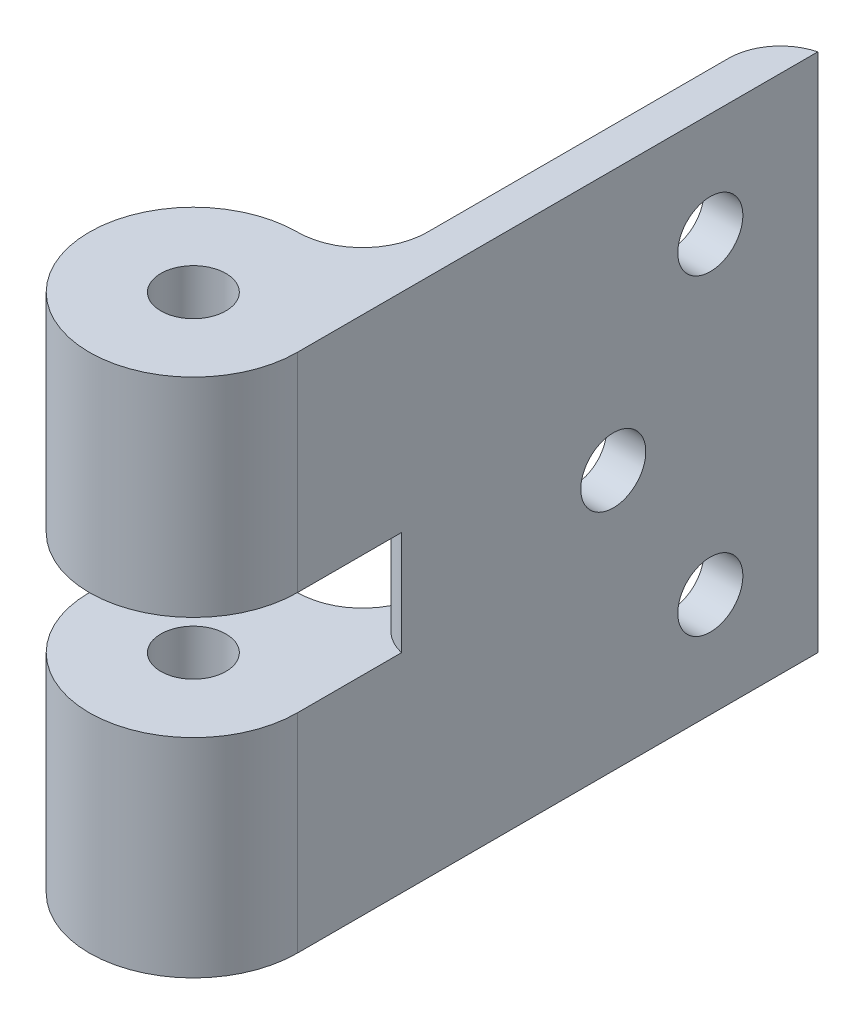
from build123d import *

# Parameters (mm, degrees)
SKETCH1_R               = 1.25
BOSS_EXTRUDE1_DEPTH     = 20
CUT_EXTRUDE1_DEPTH      = 30.021543722
CUT_EXTRUDE1_DEPTH_BACK = 30.021543722
SKETCH2_R               = 1.25
CUT_EXTRUDE2_DEPTH      = 29.565713714
CUT_EXTRUDE2_DEPTH_BACK = 29.565713714
SKETCH3_W               = 8
SKETCH3_H               = 4
FILLET1_R               = 2


with BuildPart() as part:
    # Sketch1 → Boss-Extrude1 (new body)
    with BuildSketch(Plane(origin=(0, 0, 0), x_dir=(1, 0, 0), z_dir=(0, 1, 0))):
        with BuildLine():
            Line((4, 0), (4, 20))
            Line((4, 20), (2.5, 20))
            Line((2.5, 20), (2.5, 15.120027663))
            Line((2.5, 15.120027663), (2.5, 6.5))
            ThreePointArc((2.5, 6.5), (1.767766953, 4.732233047), (0, 4))
            ThreePointArc((0, 4), (-2.828427125, -2.828427125), (4, 0))
        make_face()
        with Locations(Location((0, 0, 0), (0, 0, 270))):
            Circle(SKETCH1_R, mode=Mode.SUBTRACT)
    extrude(amount=BOSS_EXTRUDE1_DEPTH)

    # Sketch2 → Cut-Extrude1 (cut, two sides: drawn at the far end of the back side and taken through both)
    with BuildSketch(Plane.ZY.offset(-2.5).offset(-CUT_EXTRUDE1_DEPTH_BACK)):
        with Locations((-12.139236455, 10)):
            Circle(SKETCH2_R)
        with Locations((-15.86873762, 4)):
            Circle(SKETCH2_R)
        with Locations((-15.86873762, 16)):
            Circle(SKETCH2_R)
    extrude(amount=CUT_EXTRUDE1_DEPTH + CUT_EXTRUDE1_DEPTH_BACK, mode=Mode.SUBTRACT)

    # Sketch3 → Cut-Extrude2 (cut, two sides: drawn at the far end of the back side and taken through both)
    with BuildSketch(Plane(origin=(0, 0, 0), x_dir=(0, 0, -1), z_dir=(1, 0, 0)).offset(-CUT_EXTRUDE2_DEPTH_BACK)):
        with Locations((0, 10)):
            Rectangle(SKETCH3_W, SKETCH3_H)
    extrude(amount=CUT_EXTRUDE2_DEPTH + CUT_EXTRUDE2_DEPTH_BACK, mode=Mode.SUBTRACT)

    # Fillet1
    # the kernel refuses this fillet: 2 mm, written as the material it takes off along each edge
    with BuildSketch(Plane(origin=(2.5, -4.841229183, -20), x_dir=(0, 0, 1), z_dir=(0, 1, 0))) as fillet1_piece_1:
        with BuildLine():
            CenterArc((1.936491673, 2), FILLET1_R, 194.477512186, 75.522487814)
            Line((0, 1.5), (-0.038729833, 1.49))
            ThreePointArc((-0.038729833, 1.49), (-0.04, 0.75), (-0.04, 0))
            Line((-0.04, 0), (0, -0.04))
            Line((0, -0.04), (1.936491673, -0.04))
            Line((1.936491673, -0.04), (1.936491673, 0))
        make_face()
    extrude(amount=29.682458366, mode=Mode.SUBTRACT)
    with BuildSketch(Plane(origin=(0, 8, -4), x_dir=(0.7494414478105039, 0, -0.6620706278817206), z_dir=(0, 1, 0))) as fillet1_piece_2:
        with BuildLine():
            CenterArc((4.634494395, -1.498882896), FILLET1_R, 131.457982482, 83.620629792)
            Line((2.997765791, -2.648282512), (2.965031219, -2.671270504))
            ThreePointArc((2.965031219, -2.671270504), (1.472400071, -1.354118914), (-0.026482825, -0.029977658))
            Line((-0.026482825, -0.029977658), (0.026482825, 0.029977658))
            ThreePointArc((0.026482825, 0.029977658), (1.65517657, -0.58639638), (3.283870314, 0.029977658))
            Line((3.283870314, 0.029977658), (3.310353139, 0))
        make_face()
    extrude(amount=4, mode=Mode.SUBTRACT)


solid = part.part
